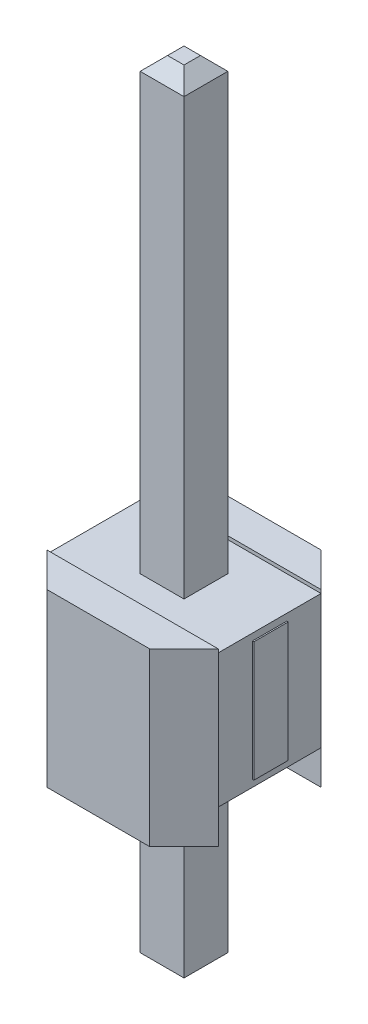
from build123d import *

# Parameters (mm, degrees)
SKETCH1_W           = 0.64
SKETCH1_H           = 11.54
BOSS_EXTRUDE1_DEPTH = 0.32
BOSS_EXTRUDE3_DEPTH = 1.25
CHAMFER1_SIZE       = 0.5
SKETCH3_W           = 0.5
SKETCH3_H           = 1.75
BOSS_EXTRUDE4_DEPTH = 1.27
CHAMFER2_SIZE       = 0.2


with BuildPart() as part:
    # Sketch1 → Boss-Extrude1 (new, symmetric)
    with BuildSketch(Plane(origin=(0, 0, 0), x_dir=(0, 0, -1), z_dir=(1, 0, 0))):
        with Locations((0, 1.98)):
            Rectangle(SKETCH1_W, SKETCH1_H)
    extrude(amount=BOSS_EXTRUDE1_DEPTH, both=True)

    # Sketch2 → Boss-Extrude3 (add, symmetric)
    with BuildSketch(Plane(origin=(0, 0, 0), x_dir=(0, -1, 0), z_dir=(1, 0, 0))):
        Polygon((-1.25, 1.25), (1.25, 1.25), (1.25, 0.75), (0.75, 0.75), (0.75, -0.75), (1.25, -0.75), (1.25, -1.25), (-1.25, -1.25), (-1.25, -0.75), (-1.2, -0.75), (-1.2, 0.75), (-1.25, 0.75), align=None)
    extrude(amount=BOSS_EXTRUDE3_DEPTH, both=True)

    # Chamfer1
    chamfer1_edges = [part.edges().sort_by_distance(p)[0] for p in [
        (1.25, 0, 1.25),
        (1.25, 0, -1.25),
        (-1.25, 0, 1.25),
        (-1.25, 0, -1.25),
    ]]
    chamfer(chamfer1_edges, length=CHAMFER1_SIZE - 0.0001)  # a hair under: the kernel refuses the full size

    # Sketch3 → Boss-Extrude4 (add, symmetric)
    with BuildSketch(Plane(origin=(0, 0, 0), x_dir=(0, 0, -1), z_dir=(1, 0, 0))):
        with Locations((0, 0.225)):
            Rectangle(SKETCH3_W, SKETCH3_H)
    extrude(amount=BOSS_EXTRUDE4_DEPTH, both=True)

    # Chamfer2
    chamfer2_edges = [part.edges().sort_by_distance(p)[0] for p in [
        (0.32, -3.79, 0),
        (0.32, 7.75, 0),
        (-0.32, -3.79, 0),
        (-0.32, 7.75, 0),
        (0, 7.75, -0.32),
        (0, -3.79, -0.32),
        (0, -3.79, 0.32),
        (0, 7.75, 0.32),
    ]]
    chamfer(chamfer2_edges, length=CHAMFER2_SIZE)


solid = part.part
